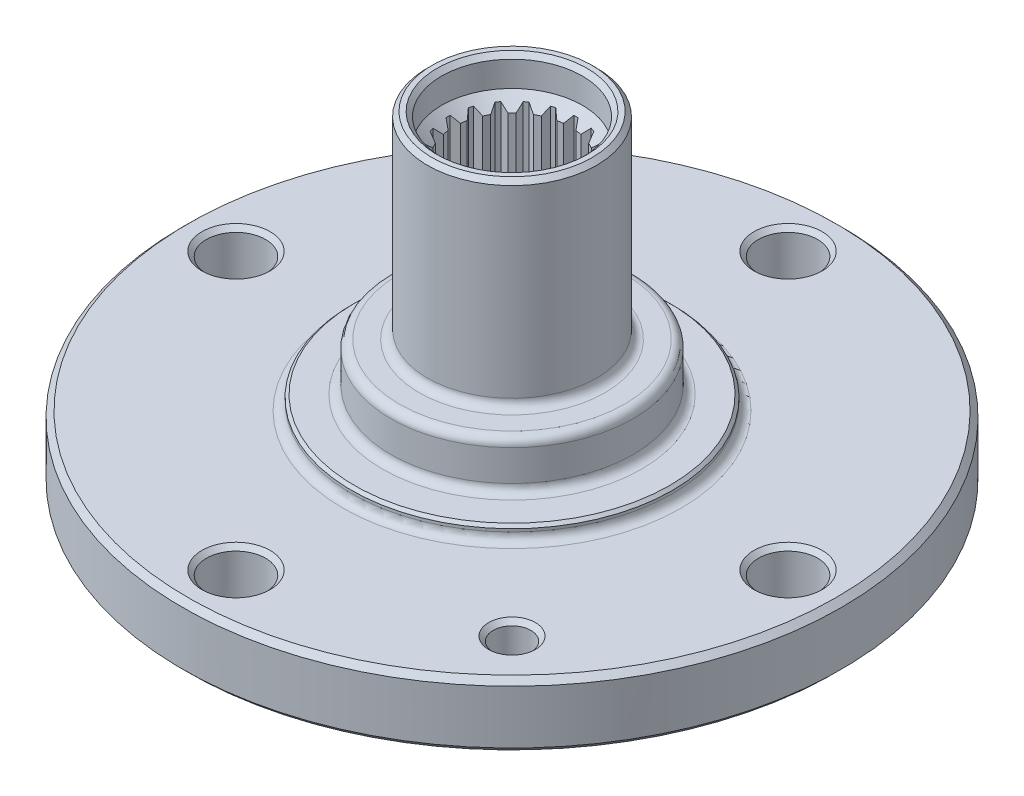
from build123d import *
from OCP.BRepFilletAPI import BRepFilletAPI_MakeChamfer

# Parameters (mm, degrees)
CHAMFER8_SIZE      = 2.5
SKETCH2_R          = 5.25
SKETCH2_R_2        = 3.35
CUT_EXTRUDE1_DEPTH = 15
CUT_EXTRUDE2_DEPTH = 100
CHAMFER1_SIZE      = 0.8
CHAMFER2_SIZE      = 1
FILLET1_R          = 1.5
CHAMFER3_SIZE      = 1
CHAMFER4_SIZE      = 0.8
CHAMFER4_SIZE2     = 1.149633335
FILLET2_R          = 0.5
FILLET3_R          = 1.5
CHAMFER5_SIZE      = 0.5
FILLET4_R          = 1.5
CHAMFER6_SIZE      = 0.8


# Some blends are built 0.0001 mm under size
with BuildPart() as part:
    # Sketch1 → Revolve1 (revolve)
    with BuildSketch(Plane.XY, mode=Mode.PRIVATE) as revolve1_sk:
        Polygon((12.5, 68.292273338), (12.5, 63.292273338), (10.3, 63.292273338), (10.3, 9.792273338), (23.25, 9.792273338), (23.25, -0.207726662), (25.75, -9.207726662), (29, -9.207726662), (29, 2.292273338), (29.5, 2.292273338), (29.5, 10.792273338), (58.5, 10.792273338), (58.5, 22.292273338), (28.5, 22.292273338), (28.5, 24.792273338), (21.5, 24.792273338), (21.5, 33.292273338), (15, 33.292273338), (15, 68.292273338), align=None)
    revolve(revolve1_sk.sketch.rotate(Axis((0, 83.796023836, 0), (0, -1, 0)), 180), axis=Axis((0, 83.796023836, 0), (0, -1, 0)))

    # Chamfer8
    # the kernel refuses this chamfer: 2.5 mm, written as the material it takes off along each edge
    with BuildSketch(Plane(origin=(0, 63.292273338, 0), x_dir=(-1, 0, 0), z_dir=(0, 0, 1))) as chamfer8_piece_1_section:
        Polygon((10.3 + CHAMFER8_SIZE, 0), (10.3, CHAMFER8_SIZE), (10.3, 0), align=None)
    chamfer8_piece_1 = revolve(axis=Axis((0, 63.292273338, 0), (0, -1, 0)), mode=Mode.PRIVATE)
    chamfer8_piece_1 = chamfer8_piece_1 & Plane(origin=(0, 61.900483119, 0), x_dir=(-1, 0, 0), z_dir=(0, -1, 0)) * Cylinder(12.5, 52, mode=Mode.PRIVATE)
    add(chamfer8_piece_1, mode=Mode.SUBTRACT)

    # Sketch2 → Cut-Extrude1 (cut)
    with BuildSketch(Plane.XZ.offset(-10.792273338)):
        with Locations((-49, 0)):
            Circle(SKETCH2_R)
        with Locations((-34.648232278, -34.648232278)):
            Circle(SKETCH2_R_2)
        with Locations((0, 49)):
            Circle(SKETCH2_R)
        with Locations((49, 0)):
            Circle(SKETCH2_R)
        with Locations((34.648232278, 34.648232278)):
            Circle(SKETCH2_R_2)
        with Locations((0, -49)):
            Circle(SKETCH2_R)
    extrude(amount=-CUT_EXTRUDE1_DEPTH, mode=Mode.SUBTRACT)

    # Sketch3 → Cut-Extrude2 (cut)
    with BuildSketch(Plane.XZ.offset(-9.792273338)):
        with BuildLine():
            ThreePointArc((-4.20394168, 9.403024745), (-3.182875042, 9.795882118), (-2.12589901, 10.078221738))
            Line((-2.12589901, 10.078221738), (-3.14878183, 10.904479492))
            ThreePointArc((-3.14878183, 10.904479492), (-3.507342886, 10.79449146), (-3.862074217, 10.672716746))
            Line((-3.862074217, 10.672716746), (-4.20394168, 9.403024745))
        make_face()
        with BuildLine():
            Line((-0.375, 11.343803375), (-1.092491684, 10.241897379))
            ThreePointArc((-1.092491684, 10.241897379), (0, 10.3), (1.092491684, 10.241897379))
            Line((1.092491684, 10.241897379), (0.375, 11.343803375))
            ThreePointArc((0.375, 11.343803375), (0, 11.35), (-0.375, 11.343803375))
        make_face()
        with BuildLine():
            Line((3.14878183, 10.904479492), (2.12589901, 10.078221738))
            ThreePointArc((2.12589901, 10.078221738), (3.182875042, 9.795882118), (4.20394168, 9.403024745))
            Line((4.20394168, 9.403024745), (3.862074217, 10.672716746))
            ThreePointArc((3.862074217, 10.672716746), (3.507342886, 10.79449146), (3.14878183, 10.904479492))
        make_face()
        with BuildLine():
            Line((6.364338956, 9.39774918), (5.136191896, 8.928019534))
            ThreePointArc((5.136191896, 8.928019534), (6.054188099, 8.332875042), (6.903880573, 7.643718534))
            Line((6.903880573, 7.643718534), (6.971101701, 8.956910241))
            ThreePointArc((6.971101701, 8.956910241), (6.671362614, 9.182342886), (6.364338956, 9.39774918))
        make_face()
        with BuildLine():
            Line((8.956910241, 6.971101701), (7.643718534, 6.903880573))
            ThreePointArc((7.643718534, 6.903880573), (8.332875042, 6.054188099), (8.928019534, 5.136191896))
            Line((8.928019534, 5.136191896), (9.39774918, 6.364338956))
            ThreePointArc((9.39774918, 6.364338956), (9.182342886, 6.671362614), (8.956910241, 6.971101701))
        make_face()
        with BuildLine():
            Line((10.672716746, 3.862074217), (9.403024745, 4.20394168))
            ThreePointArc((9.403024745, 4.20394168), (9.795882118, 3.182875042), (10.078221738, 2.12589901))
            Line((10.078221738, 2.12589901), (10.904479492, 3.14878183))
            ThreePointArc((10.904479492, 3.14878183), (10.79449146, 3.507342886), (10.672716746, 3.862074217))
        make_face()
        with BuildLine():
            Line((11.343803375, 0.375), (10.241897379, 1.092491684))
            ThreePointArc((10.241897379, 1.092491684), (10.285464088, 0.547017823), (10.3, 0))
            ThreePointArc((10.3, 0), (10.285464088, -0.547017823), (10.241897379, -1.092491684))
            Line((10.241897379, -1.092491684), (11.343803375, -0.375))
            ThreePointArc((11.343803375, -0.375), (11.35, 0), (11.343803375, 0.375))
        make_face()
        with BuildLine():
            Line((10.904479492, -3.14878183), (10.078221738, -2.12589901))
            ThreePointArc((10.078221738, -2.12589901), (9.795882118, -3.182875042), (9.403024745, -4.20394168))
            Line((9.403024745, -4.20394168), (10.672716746, -3.862074217))
            ThreePointArc((10.672716746, -3.862074217), (10.79449146, -3.507342886), (10.904479492, -3.14878183))
        make_face()
        with BuildLine():
            Line((9.39774918, -6.364338956), (8.928019534, -5.136191896))
            ThreePointArc((8.928019534, -5.136191896), (8.332875042, -6.054188099), (7.643718534, -6.903880573))
            Line((7.643718534, -6.903880573), (8.956910241, -6.971101701))
            ThreePointArc((8.956910241, -6.971101701), (9.182342886, -6.671362614), (9.39774918, -6.364338956))
        make_face()
        with BuildLine():
            Line((6.971101701, -8.956910241), (6.903880573, -7.643718534))
            ThreePointArc((6.903880573, -7.643718534), (6.054188099, -8.332875042), (5.136191896, -8.928019534))
            Line((5.136191896, -8.928019534), (6.364338956, -9.39774918))
            ThreePointArc((6.364338956, -9.39774918), (6.671362614, -9.182342886), (6.971101701, -8.956910241))
        make_face()
        with BuildLine():
            Line((3.862074217, -10.672716746), (4.20394168, -9.403024745))
            ThreePointArc((4.20394168, -9.403024745), (3.182875042, -9.795882118), (2.12589901, -10.078221738))
            Line((2.12589901, -10.078221738), (3.14878183, -10.904479492))
            ThreePointArc((3.14878183, -10.904479492), (3.507342886, -10.79449146), (3.862074217, -10.672716746))
        make_face()
        with BuildLine():
            ThreePointArc((1.092491684, -10.241897379), (0, -10.3), (-1.092491684, -10.241897379))
            Line((-1.092491684, -10.241897379), (-0.375, -11.343803375))
            ThreePointArc((-0.375, -11.343803375), (0, -11.35), (0.375, -11.343803375))
            Line((0.375, -11.343803375), (1.092491684, -10.241897379))
        make_face()
        with BuildLine():
            ThreePointArc((-2.12589901, -10.078221738), (-3.182875042, -9.795882118), (-4.20394168, -9.403024745))
            Line((-4.20394168, -9.403024745), (-3.862074217, -10.672716746))
            ThreePointArc((-3.862074217, -10.672716746), (-3.507342886, -10.79449146), (-3.14878183, -10.904479492))
            Line((-3.14878183, -10.904479492), (-2.12589901, -10.078221738))
        make_face()
        with BuildLine():
            ThreePointArc((-5.136191896, -8.928019534), (-6.054188099, -8.332875042), (-6.903880573, -7.643718534))
            Line((-6.903880573, -7.643718534), (-6.971101701, -8.956910241))
            ThreePointArc((-6.971101701, -8.956910241), (-6.671362614, -9.182342886), (-6.364338956, -9.39774918))
            Line((-6.364338956, -9.39774918), (-5.136191896, -8.928019534))
        make_face()
        with BuildLine():
            ThreePointArc((-10.078221738, 2.12589901), (-9.795882118, 3.182875042), (-9.403024745, 4.20394168))
            Line((-9.403024745, 4.20394168), (-10.672716746, 3.862074217))
            ThreePointArc((-10.672716746, 3.862074217), (-10.79449146, 3.507342886), (-10.904479492, 3.14878183))
            Line((-10.904479492, 3.14878183), (-10.078221738, 2.12589901))
        make_face()
        with BuildLine():
            ThreePointArc((-8.928019534, 5.136191896), (-8.332875042, 6.054188099), (-7.643718534, 6.903880573))
            Line((-7.643718534, 6.903880573), (-8.956910241, 6.971101701))
            ThreePointArc((-8.956910241, 6.971101701), (-9.182342886, 6.671362614), (-9.39774918, 6.364338956))
            Line((-9.39774918, 6.364338956), (-8.928019534, 5.136191896))
        make_face()
        with BuildLine():
            ThreePointArc((-6.903880573, 7.643718534), (-6.054188099, 8.332875042), (-5.136191896, 8.928019534))
            Line((-5.136191896, 8.928019534), (-6.364338956, 9.39774918))
            ThreePointArc((-6.364338956, 9.39774918), (-6.671362614, 9.182342886), (-6.971101701, 8.956910241))
            Line((-6.971101701, 8.956910241), (-6.903880573, 7.643718534))
        make_face()
        with BuildLine():
            Line((-9.39774918, -6.364338956), (-8.824901509, -4.86658128))
            Line((-8.824901509, -4.86658128), (-7.355438378, -6.889123766))
            Line((-7.355438378, -6.889123766), (-8.956910241, -6.971101701))
            ThreePointArc((-8.956910241, -6.971101701), (-9.182342886, -6.671362614), (-9.39774918, -6.364338956))
        make_face()
        with BuildLine():
            Line((-10.904479492, -3.14878183), (-9.896836406, -1.901349298))
            Line((-9.896836406, -1.901349298), (-9.12429392, -4.278990589))
            Line((-9.12429392, -4.278990589), (-10.672716746, -3.862074217))
            ThreePointArc((-10.672716746, -3.862074217), (-10.79449146, -3.507342886), (-10.904479492, -3.14878183))
        make_face()
        with BuildLine():
            Line((-11.343803375, 0.375), (-10, 1.25))
            Line((-10, 1.25), (-10, -1.25))
            Line((-10, -1.25), (-11.343803375, -0.375))
            ThreePointArc((-11.343803375, -0.375), (-11.35, 0), (-11.343803375, 0.375))
        make_face()
    extrude(amount=-CUT_EXTRUDE2_DEPTH, mode=Mode.SUBTRACT)

    # Chamfer1
    chamfer1_edges = [part.edges().sort_by_distance(p)[0] for p in [
        (-54.25, 22.292273338, 0),
        (-54.25, 10.792273338, 0),
        (-37.998232278, 22.292273338, -34.648232278),
        (-37.998232278, 10.792273338, -34.648232278),
        (31.298232278, 22.292273338, 34.648232278),
        (31.298232278, 10.792273338, 34.648232278),
        (-5.25, 22.292273338, 49),
        (-5.25, 10.792273338, 49),
        (43.75, 22.292273338, 0),
        (43.75, 10.792273338, 0),
        (-5.25, 22.292273338, -49),
        (-5.25, 10.792273338, -49),
    ]]
    chamfer(chamfer1_edges, length=CHAMFER1_SIZE)

    # Chamfer2
    chamfer2_edges = [part.edges().sort_by_distance(p)[0] for p in [
        (58.5, 22.292273338, 0),
        (58.5, 10.792273338, 0),
    ]]
    chamfer(chamfer2_edges, length=CHAMFER2_SIZE)

    # Fillet1
    fillet1_edges = [part.edges().sort_by_distance(p)[0] for p in [
        (29.5, 10.792273338, 0),
    ]]
    fillet(fillet1_edges, radius=FILLET1_R)

    # Chamfer3
    chamfer3_edges = [part.edges().sort_by_distance(p)[0] for p in [
        (23.25, 9.792273338, 0),
    ]]
    chamfer(chamfer3_edges, length=CHAMFER3_SIZE)

    # Chamfer4: one chamfer whose edges measure the first distance from different faces: ONE call of the kernel's chamfer builder (chamfer() names one face for all edges)
    chamfer4_edges_1 = [part.edges().sort_by_distance(p)[0] for p in [
        (29, -9.207726662, 0),
    ]]
    chamfer4_edges_2 = [part.edges().sort_by_distance(p)[0] for p in [
        (25.75, -9.207726662, 0),
    ]]
    chamfer4_side_2 = [part.faces().sort_by_distance(p)[0] for p in [
        (24.5, -4.707726662, 0),
    ]]
    chamfer4 = BRepFilletAPI_MakeChamfer(part.part.solid().wrapped)
    for e in chamfer4_edges_1:
        chamfer4.Add(CHAMFER4_SIZE, e.wrapped)
    for e in chamfer4_edges_2:
        chamfer4.Add(CHAMFER4_SIZE, CHAMFER4_SIZE2, e.wrapped, chamfer4_side_2[0].wrapped)  # the first distance lies on this face
    add(Compound.cast(chamfer4.Shape()), mode=Mode.REPLACE)

    # Fillet2
    fillet2_edges = [part.edges().sort_by_distance(p)[0] for p in [
        (29.5, 2.292273338, 0),
    ]]
    fillet(fillet2_edges, radius=FILLET2_R - 0.0001)  # a hair under: the kernel refuses the full size

    # Fillet3
    fillet3_edges = [part.edges().sort_by_distance(p)[0] for p in [
        (28.5, 22.292273338, 0),
    ]]
    fillet(fillet3_edges, radius=FILLET3_R)

    # Chamfer5
    chamfer5_edges = [part.edges().sort_by_distance(p)[0] for p in [
        (28.5, 24.792273338, 0),
    ]]
    chamfer(chamfer5_edges, length=CHAMFER5_SIZE)

    # Fillet4
    fillet4_edges = [part.edges().sort_by_distance(p)[0] for p in [
        (15, 33.292273338, 0),
        (21.5, 33.292273338, 0),
        (21.5, 24.792273338, 0),
    ]]
    fillet(fillet4_edges, radius=FILLET4_R)

    # Chamfer6
    chamfer6_edges = [part.edges().sort_by_distance(p)[0] for p in [
        (15, 68.292273338, 0),
        (12.5, 68.292273338, 0),
    ]]
    chamfer(chamfer6_edges, length=CHAMFER6_SIZE)


solid = part.part
